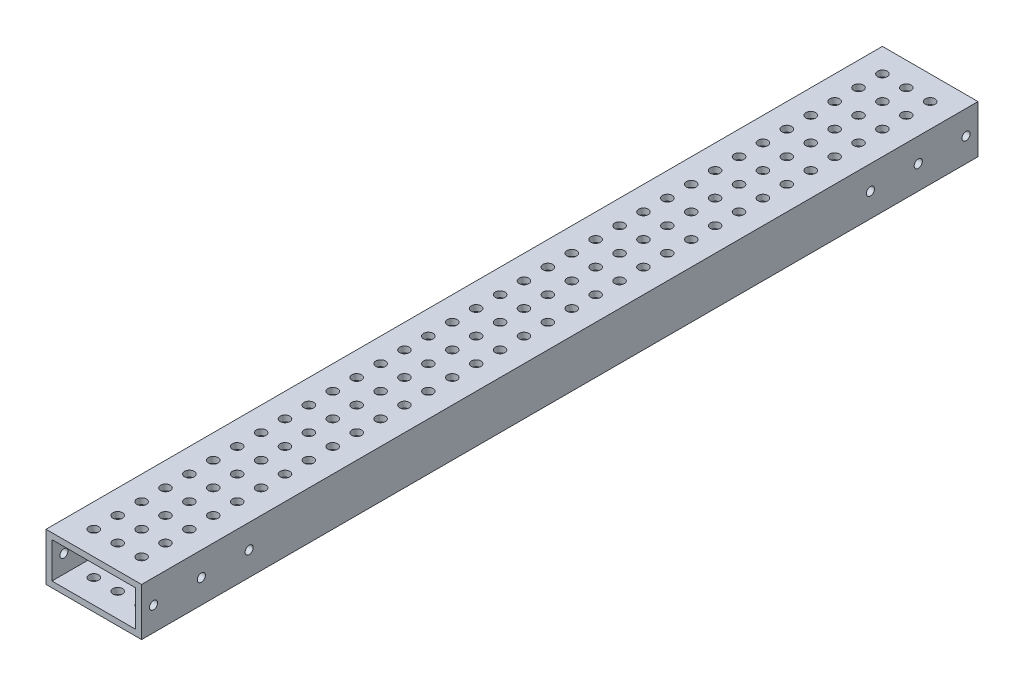
from build123d import *

# Parameters (mm, degrees)
SKETCH1_W           = 50.8
SKETCH1_H           = 25.4
SKETCH1_W_2         = 44.45
SKETCH1_H_2         = 19.05
BOSS_EXTRUDE1_DEPTH = 222.25
SKETCH2_R           = 2.5527
CUT_EXTRUDE1_DEPTH  = 226.134143346
SKETCH3_R           = 2.159
CUT_EXTRUDE2_DEPTH  = 229.335263374


with BuildPart() as part:
    # Sketch1 → Boss-Extrude1 (new, symmetric)
    with BuildSketch(Plane.XY):
        Rectangle(SKETCH1_W, SKETCH1_H)
        Rectangle(SKETCH1_W_2, SKETCH1_H_2, mode=Mode.SUBTRACT)
    extrude(amount=BOSS_EXTRUDE1_DEPTH, both=True)

    # Sketch2 → Cut-Extrude1 (cut, through all)
    with BuildSketch(Plane(origin=(0, 12.7, 0), x_dir=(1, 0, 0), z_dir=(0, 1, 0))):
        with Locations((0, -209.55)):
            Circle(SKETCH2_R)
        with Locations((12.7, -209.55)):
            Circle(SKETCH2_R)
        with Locations((-12.7, -209.55)):
            Circle(SKETCH2_R)
        with Locations((-12.7, -196.85)):
            Circle(SKETCH2_R)
        with Locations((0, -196.85)):
            Circle(SKETCH2_R)
        with Locations((12.7, -196.85)):
            Circle(SKETCH2_R)
        with Locations((-12.7, -184.15)):
            Circle(SKETCH2_R)
        with Locations((0, -184.15)):
            Circle(SKETCH2_R)
        with Locations((12.7, -184.15)):
            Circle(SKETCH2_R)
        with Locations((-12.7, -171.45)):
            Circle(SKETCH2_R)
        with Locations((0, -171.45)):
            Circle(SKETCH2_R)
        with Locations((12.7, -171.45)):
            Circle(SKETCH2_R)
        with Locations((-12.7, -158.75)):
            Circle(SKETCH2_R)
        with Locations((0, -158.75)):
            Circle(SKETCH2_R)
        with Locations((12.7, -158.75)):
            Circle(SKETCH2_R)
        with Locations((-12.7, -146.05)):
            Circle(SKETCH2_R)
        with Locations((0, -146.05)):
            Circle(SKETCH2_R)
        with Locations((12.7, -146.05)):
            Circle(SKETCH2_R)
        with Locations((-12.7, -133.35)):
            Circle(SKETCH2_R)
        with Locations((0, -133.35)):
            Circle(SKETCH2_R)
        with Locations((12.7, -133.35)):
            Circle(SKETCH2_R)
        with Locations((-12.7, -120.65)):
            Circle(SKETCH2_R)
        with Locations((0, -120.65)):
            Circle(SKETCH2_R)
        with Locations((12.7, -120.65)):
            Circle(SKETCH2_R)
        with Locations((-12.7, -107.95)):
            Circle(SKETCH2_R)
        with Locations((0, -107.95)):
            Circle(SKETCH2_R)
        with Locations((12.7, -107.95)):
            Circle(SKETCH2_R)
        with Locations((-12.7, -95.25)):
            Circle(SKETCH2_R)
        with Locations((0, -95.25)):
            Circle(SKETCH2_R)
        with Locations((12.7, -95.25)):
            Circle(SKETCH2_R)
        with Locations((-12.7, -82.55)):
            Circle(SKETCH2_R)
        with Locations((0, -82.55)):
            Circle(SKETCH2_R)
        with Locations((12.7, -82.55)):
            Circle(SKETCH2_R)
        with Locations((-12.7, -69.85)):
            Circle(SKETCH2_R)
        with Locations((0, -69.85)):
            Circle(SKETCH2_R)
        with Locations((12.7, -69.85)):
            Circle(SKETCH2_R)
        with Locations((-12.7, -57.15)):
            Circle(SKETCH2_R)
        with Locations((0, -57.15)):
            Circle(SKETCH2_R)
        with Locations((12.7, -57.15)):
            Circle(SKETCH2_R)
        with Locations((-12.7, -44.45)):
            Circle(SKETCH2_R)
        with Locations((0, -44.45)):
            Circle(SKETCH2_R)
        with Locations((12.7, -44.45)):
            Circle(SKETCH2_R)
        with Locations((-12.7, -31.75)):
            Circle(SKETCH2_R)
        with Locations((0, -31.75)):
            Circle(SKETCH2_R)
        with Locations((12.7, -31.75)):
            Circle(SKETCH2_R)
        with Locations((-12.7, -19.05)):
            Circle(SKETCH2_R)
        with Locations((0, -19.05)):
            Circle(SKETCH2_R)
        with Locations((12.7, -19.05)):
            Circle(SKETCH2_R)
        with Locations((-12.7, -6.35)):
            Circle(SKETCH2_R)
        with Locations((0, -6.35)):
            Circle(SKETCH2_R)
        with Locations((12.7, -6.35)):
            Circle(SKETCH2_R)
        with Locations((-12.7, 6.35)):
            Circle(SKETCH2_R)
        with Locations((0, 6.35)):
            Circle(SKETCH2_R)
        with Locations((12.7, 6.35)):
            Circle(SKETCH2_R)
        with Locations((-12.7, 19.05)):
            Circle(SKETCH2_R)
        with Locations((0, 19.05)):
            Circle(SKETCH2_R)
        with Locations((12.7, 19.05)):
            Circle(SKETCH2_R)
        with Locations((-12.7, 31.75)):
            Circle(SKETCH2_R)
        with Locations((0, 31.75)):
            Circle(SKETCH2_R)
        with Locations((12.7, 31.75)):
            Circle(SKETCH2_R)
        with Locations((-12.7, 44.45)):
            Circle(SKETCH2_R)
        with Locations((0, 44.45)):
            Circle(SKETCH2_R)
        with Locations((12.7, 44.45)):
            Circle(SKETCH2_R)
        with Locations((-12.7, 57.15)):
            Circle(SKETCH2_R)
        with Locations((0, 57.15)):
            Circle(SKETCH2_R)
        with Locations((12.7, 57.15)):
            Circle(SKETCH2_R)
        with Locations((-12.7, 69.85)):
            Circle(SKETCH2_R)
        with Locations((0, 69.85)):
            Circle(SKETCH2_R)
        with Locations((12.7, 69.85)):
            Circle(SKETCH2_R)
        with Locations((-12.7, 82.55)):
            Circle(SKETCH2_R)
        with Locations((0, 82.55)):
            Circle(SKETCH2_R)
        with Locations((12.7, 82.55)):
            Circle(SKETCH2_R)
        with Locations((-12.7, 95.25)):
            Circle(SKETCH2_R)
        with Locations((0, 95.25)):
            Circle(SKETCH2_R)
        with Locations((12.7, 95.25)):
            Circle(SKETCH2_R)
        with Locations((-12.7, 107.95)):
            Circle(SKETCH2_R)
        with Locations((0, 107.95)):
            Circle(SKETCH2_R)
        with Locations((12.7, 107.95)):
            Circle(SKETCH2_R)
        with Locations((-12.7, 120.65)):
            Circle(SKETCH2_R)
        with Locations((0, 120.65)):
            Circle(SKETCH2_R)
        with Locations((12.7, 120.65)):
            Circle(SKETCH2_R)
        with Locations((-12.7, 133.35)):
            Circle(SKETCH2_R)
        with Locations((0, 133.35)):
            Circle(SKETCH2_R)
        with Locations((12.7, 133.35)):
            Circle(SKETCH2_R)
        with Locations((-12.7, 146.05)):
            Circle(SKETCH2_R)
        with Locations((0, 146.05)):
            Circle(SKETCH2_R)
        with Locations((12.7, 146.05)):
            Circle(SKETCH2_R)
        with Locations((-12.7, 158.75)):
            Circle(SKETCH2_R)
        with Locations((0, 158.75)):
            Circle(SKETCH2_R)
        with Locations((12.7, 158.75)):
            Circle(SKETCH2_R)
        with Locations((-12.7, 171.45)):
            Circle(SKETCH2_R)
        with Locations((0, 171.45)):
            Circle(SKETCH2_R)
        with Locations((12.7, 171.45)):
            Circle(SKETCH2_R)
        with Locations((-12.7, 184.15)):
            Circle(SKETCH2_R)
        with Locations((0, 184.15)):
            Circle(SKETCH2_R)
        with Locations((12.7, 184.15)):
            Circle(SKETCH2_R)
        with Locations((-12.7, 196.85)):
            Circle(SKETCH2_R)
        with Locations((0, 196.85)):
            Circle(SKETCH2_R)
        with Locations((12.7, 196.85)):
            Circle(SKETCH2_R)
        with Locations((-12.7, 209.55)):
            Circle(SKETCH2_R)
        with Locations((0, 209.55)):
            Circle(SKETCH2_R)
        with Locations((12.7, 209.55)):
            Circle(SKETCH2_R)
    extrude(amount=-CUT_EXTRUDE1_DEPTH, mode=Mode.SUBTRACT)

    # Sketch3 → Cut-Extrude2 (cut, through all)
    with BuildSketch(Plane(origin=(25.4, 0, 0), x_dir=(0, 0, -1), z_dir=(1, 0, 0))):
        with Locations((-215.9, 0)):
            Circle(SKETCH3_R)
        with Locations((-190.5, 0)):
            Circle(SKETCH3_R)
        with Locations((-165.1, 0)):
            Circle(SKETCH3_R)
        with Locations((215.9, 0)):
            Circle(SKETCH3_R)
        with Locations((190.5, 0)):
            Circle(SKETCH3_R)
        with Locations((165.1, 0)):
            Circle(SKETCH3_R)
    extrude(amount=-CUT_EXTRUDE2_DEPTH, mode=Mode.SUBTRACT)


solid = part.part
